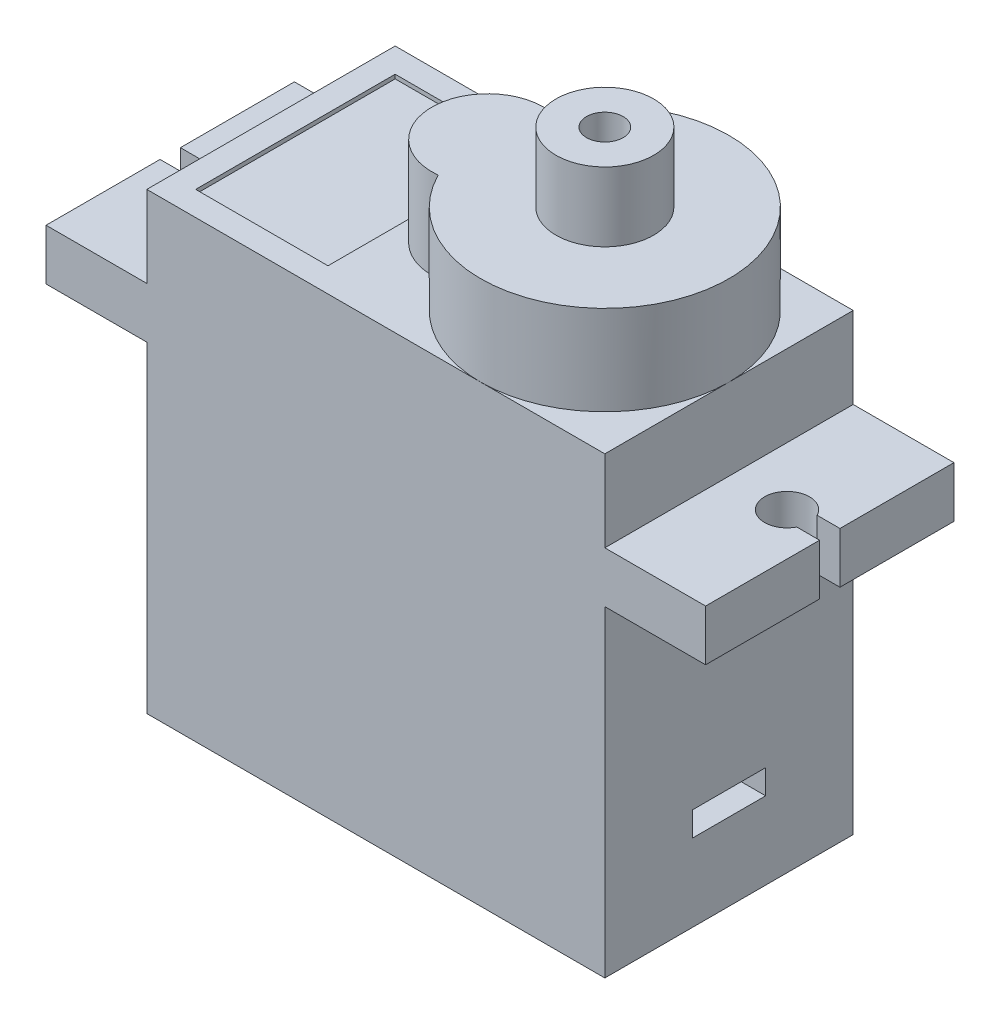
from build123d import *

# Parameters (mm, degrees)
EXTRUDE_1_DEPTH     = 12.2
SKETCH_3_W          = 3.6
SKETCH_3_H          = 1.2
CUT_EXTRUDE_1_DEPTH = 2
EXTRUDE_2_DEPTH     = 4.4
SKETCH_4_3_W        = 6.5
SKETCH_4_3_H        = 9.8
CUT_EXTRUDE_2_DEPTH = 0.2
SKETCH_5_R          = 2.4
SKETCH_5_R_2        = 0.9
EXTRUDE_3_DEPTH     = 3.4
CUT_EXTRUDE_3_REACH = 29.316


with BuildPart() as part:
    # 草图1 → 凸台-拉伸1 (new body)
    with BuildSketch(Plane.XY):
        Polygon((-11.25, 0), (11.25, 0), (11.25, 15.8), (16.2, 15.8), (16.2, 18.3), (11.25, 18.3), (11.25, 22.3), (-11.25, 22.3), (-11.25, 18.3), (-16.2, 18.3), (-16.2, 15.8), (-11.25, 15.8), align=None)
    extrude(amount=EXTRUDE_1_DEPTH)

    # 草图3 → 切除-拉伸1 (cut)
    with BuildSketch(Plane(origin=(11.25, 0, 0), x_dir=(0, 0, -1), z_dir=(1, 0, 0))):
        with Locations((-6.1, 4.4)):
            Rectangle(SKETCH_3_W, SKETCH_3_H)
    extrude(amount=-CUT_EXTRUDE_1_DEPTH, mode=Mode.SUBTRACT)

    # 草图4 → 凸台-拉伸2 (add)
    with BuildSketch(Plane(origin=(0, 22.3, 0), x_dir=(1, 0, 0), z_dir=(0, 1, 0))):
        with BuildLine():
            ThreePointArc((-0.303043478, -8.833919681), (11.25, -6.1), (-0.303043478, -3.366080319))
            ThreePointArc((-0.303043478, -3.366080319), (-3.35, -6.1), (-0.303043478, -8.833919681))
        make_face()
    extrude(amount=EXTRUDE_2_DEPTH)

    # 草图4<3> → 切除-拉伸2 (cut)
    with BuildSketch(Plane(origin=(0, 22.3, 0), x_dir=(1, 0, 0), z_dir=(0, 1, 0))):
        with Locations((-6.8, -6.1)):
            Rectangle(SKETCH_4_3_W, SKETCH_4_3_H)
    extrude(amount=-CUT_EXTRUDE_2_DEPTH, mode=Mode.SUBTRACT)

    # 草图5 → 凸台-拉伸3 (add)
    with BuildSketch(Plane(origin=(0, 26.7, 0), x_dir=(1, 0, 0), z_dir=(0, 1, 0))):
        with Locations((5.15, -6.1)):
            Circle(SKETCH_5_R)
        with Locations((5.15, -6.1)):
            Circle(SKETCH_5_R_2, mode=Mode.SUBTRACT)
    extrude(amount=EXTRUDE_3_DEPTH)

    # 草图6 → 切除-拉伸3 (cut, up to next)
    with BuildSketch(Plane(origin=(0, 18.3, 0), x_dir=(1, 0, 0), z_dir=(0, 1, 0)), mode=Mode.PRIVATE) as cut_extrude_3_sk1:
        with BuildLine():
            Line((-16.2, -6.6), (-15.079795897, -6.6))
            ThreePointArc((-15.079795897, -6.6), (-13, -6.1), (-15.079795897, -5.6))
            Line((-15.079795897, -5.6), (-16.2, -5.6))
            Line((-16.2, -5.6), (-16.2, -6.6))
        make_face()
    cut_extrude_3_tool1 = extrude(cut_extrude_3_sk1.sketch, amount=-CUT_EXTRUDE_3_REACH, mode=Mode.PRIVATE) & part.part
    cut_extrude_3 = cut_extrude_3_tool1.solids().sort_by_distance((-14.439154, 18.3, 6.1))[0]
    add(cut_extrude_3, mode=Mode.SUBTRACT)

    # 镜向1: 切除-拉伸3 across plane
    add(cut_extrude_3.mirror(Plane(origin=(0, 0, 0), x_dir=(0, 0, 1), z_dir=(1, 0, 0))), mode=Mode.SUBTRACT)


solid = part.part
